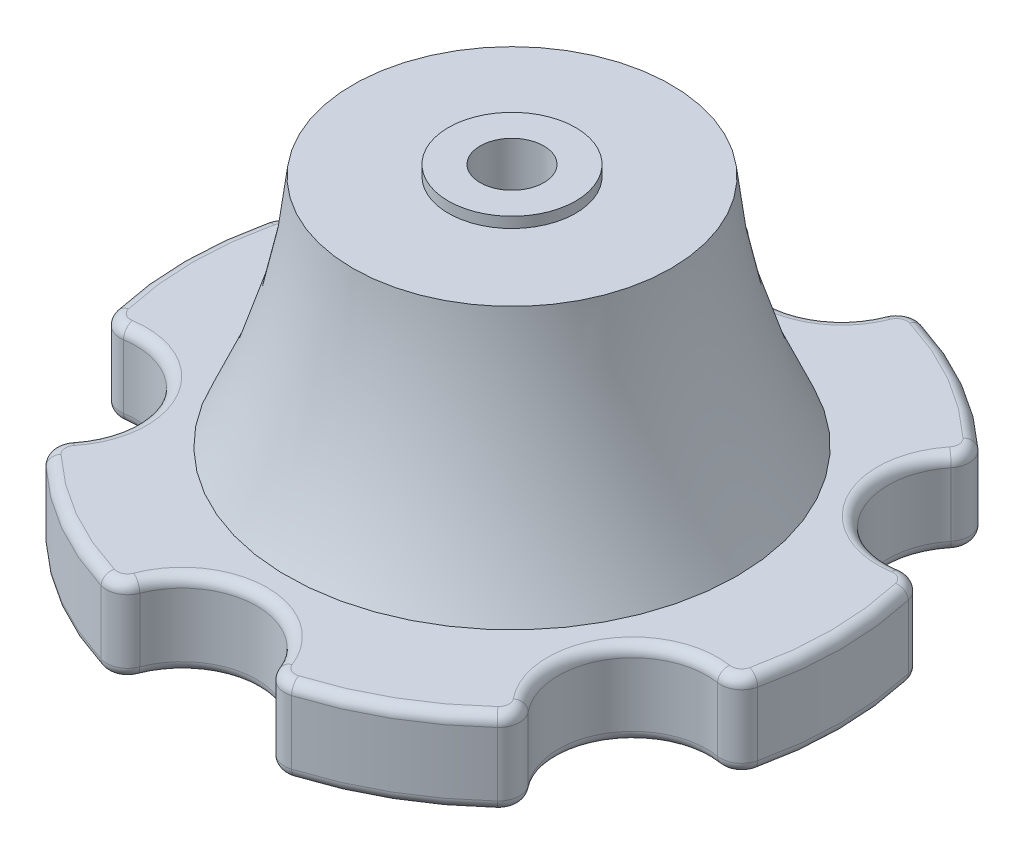
from build123d import *

# Parameters (mm, degrees)
EXTRUDE_1_DEPTH     = 15
SKETCH_3_R          = 1.5
CUT_EXTRUDE_1_DEPTH = 15
SKETCH_4_R          = 3
CUT_EXTRUDE_2_DEPTH = 6
FILLET_1_R          = 1
FILLET_2_R          = 0.5
SKETCH_5_R          = 3
SKETCH_5_R_2        = 1.5
EXTRUDE_2_DEPTH     = 0.5


with BuildPart() as part:
    # Эскиз1 → Бобышка-Вытянуть1 (new body)
    with BuildSketch(Plane(origin=(0, 0, 0), x_dir=(1, 0, 0), z_dir=(0, 1, 0))):
        with BuildLine():
            ThreePointArc((-3.477707616, 15.135602061), (0, 12.03), (3.477707616, 15.135602061))
            ThreePointArc((3.477707616, 15.135602061), (7.765, 13.449374521), (11.368962078, 10.579584173))
            ThreePointArc((11.368962078, 10.579584173), (10.418285608, 6.015), (14.846669694, 4.556017888))
            ThreePointArc((14.846669694, 4.556017888), (15.53, 0), (14.846669694, -4.556017888))
            ThreePointArc((14.846669694, -4.556017888), (10.418285608, -6.015), (11.368962078, -10.579584173))
            ThreePointArc((11.368962078, -10.579584173), (7.765, -13.449374521), (3.477707616, -15.135602061))
            ThreePointArc((3.477707616, -15.135602061), (0, -12.03), (-3.477707616, -15.135602061))
            ThreePointArc((-3.477707616, -15.135602061), (-7.765, -13.449374521), (-11.368962078, -10.579584173))
            ThreePointArc((-11.368962078, -10.579584173), (-10.418285608, -6.015), (-14.846669694, -4.556017888))
            ThreePointArc((-14.846669694, -4.556017888), (-15.53, 0), (-14.846669694, 4.556017888))
            ThreePointArc((-14.846669694, 4.556017888), (-10.418285608, 6.015), (-11.368962078, 10.579584173))
            ThreePointArc((-11.368962078, 10.579584173), (-7.765, 13.449374521), (-3.477707616, 15.135602061))
        make_face()
    extrude(amount=EXTRUDE_1_DEPTH)

    # Эскиз2 → Вырез-Повернуть1 (revolve, cut)
    with BuildSketch(Plane.XY):
        with BuildLine():
            Line((-15.6, 31), (-15.6, 4))
            Line((-15.6, 4), (-10.6, 4))
            ThreePointArc((-10.6, 4), (-7.390856649, 17.5), (-10.6, 31))
            Line((-10.6, 31), (-15.6, 31))
        make_face()
    revolve(axis=Axis((0, -1000, 0), (0, 1, 0)), mode=Mode.SUBTRACT)

    # Эскиз3 → Вырез-Вытянуть1 (cut)
    with BuildSketch(Plane.XZ):
        Circle(SKETCH_3_R)
    extrude(amount=-CUT_EXTRUDE_1_DEPTH, mode=Mode.SUBTRACT)

    # Эскиз4 → Вырез-Вытянуть2 (cut)
    with BuildSketch(Plane.XZ):
        Circle(SKETCH_4_R)
    extrude(amount=-CUT_EXTRUDE_2_DEPTH, mode=Mode.SUBTRACT)

    # Скругление1
    fillet_1_edges = [part.edges().sort_by_distance(p)[0] for p in [
        (-11.368962078, 2, 10.579584173),
        (-3.477707616, 2, 15.135602061),
        (3.477707616, 2, 15.135602061),
        (11.368962078, 2, 10.579584173),
        (14.846669694, 2, 4.556017888),
        (14.846669694, 2, -4.556017888),
        (11.368962078, 2, -10.579584173),
        (-3.477707616, 2, -15.135602061),
        (3.477707616, 2, -15.135602061),
        (-11.368962078, 2, -10.579584173),
        (-14.846669694, 2, -4.556017888),
        (-14.846669694, 2, 4.556017888),
    ]]
    fillet(fillet_1_edges, radius=FILLET_1_R)

    # Скругление2
    fillet_2_edges = [part.edges().sort_by_distance(p)[0] for p in [
        (3.759155616, 4, 14.808611742),
        (0, 4, 12.03),
        (-3.759155616, 4, 14.808611742),
        (-7.765, 4, 13.449374521),
        (-10.945056155, 4, 10.659830131),
        (-10.418285608, 4, 6.015),
        (-14.704211771, 4, 4.148781611),
        (-15.53, 4, 0),
        (-14.704211771, 4, -4.148781611),
        (-10.418285608, 4, -6.015),
        (-10.945056155, 4, -10.659830131),
        (-7.765, 4, -13.449374521),
        (-3.759155616, 4, -14.808611742),
        (0, 4, -12.03),
        (3.759155616, 4, -14.808611742),
        (7.765, 4, -13.449374521),
        (10.945056155, 4, -10.659830131),
        (10.418285608, 4, -6.015),
        (14.704211771, 4, -4.148781611),
        (15.53, 4, 0),
        (14.704211771, 4, 4.148781611),
        (10.418285608, 4, 6.015),
        (10.945056155, 4, 10.659830131),
        (-10.945056155, 0, 10.659830131),
        (-10.418285608, 0, 6.015),
        (-14.704211771, 0, 4.148781611),
        (-15.53, 0, 0),
        (-14.704211771, 0, -4.148781611),
        (-10.418285608, 0, -6.015),
        (-10.945056155, 0, -10.659830131),
        (-7.765, 0, -13.449374521),
        (-3.759155616, 0, -14.808611742),
        (0, 0, -12.03),
        (3.759155616, 0, -14.808611742),
        (7.765, 0, -13.449374521),
        (10.945056155, 0, -10.659830131),
        (10.418285608, 0, -6.015),
        (14.704211771, 0, -4.148781611),
        (15.53, 0, 0),
        (14.704211771, 0, 4.148781611),
        (10.418285608, 0, 6.015),
        (10.945056155, 0, 10.659830131),
        (7.765, 0, 13.449374521),
        (3.759155616, 0, 14.808611742),
        (0, 0, 12.03),
        (-3.759155616, 0, 14.808611742),
        (7.765, 4, 13.449374521),
        (-7.765, 0, 13.449374521),
    ]]
    fillet(fillet_2_edges, radius=FILLET_2_R)

    # Эскиз5 → Бобышка-Вытянуть2 (add)
    with BuildSketch(Plane(origin=(0, 15, 0), x_dir=(1, 0, 0), z_dir=(0, 1, 0))):
        Circle(SKETCH_5_R)
        Circle(SKETCH_5_R_2, mode=Mode.SUBTRACT)
    extrude(amount=EXTRUDE_2_DEPTH)


solid = part.part
